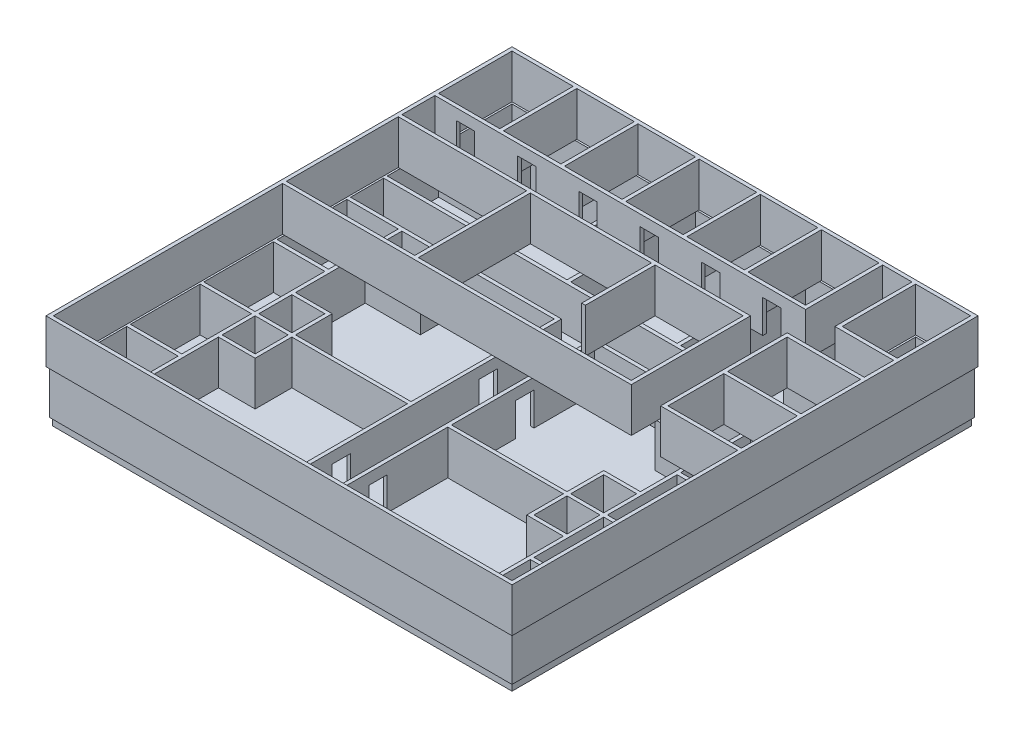
from build123d import *

# Parameters (mm, degrees)
SKETCH1_W                     = 3175
SKETCH1_H                     = 25.4
EXTRUDE_THIN7_DEPTH           = 304.8
SKETCH1_W_2                   = 3200.4
SKETCH1_H_2                   = 3200.4
SKETCH1_W_3                   = 3149.6
SKETCH1_H_3                   = 3149.6
EXTRUDE_THIN7_2_DEPTH         = 304.8
EXTRUDE_THIN7_3_DEPTH         = 304.8
EXTRUDE_THIN7_4_DEPTH         = 304.8
SKETCH1_W_4                   = 25.4
SKETCH1_H_4                   = 2032
EXTRUDE_THIN7_5_DEPTH         = 304.8
SKETCH1_W_5                   = 381
EXTRUDE_THIN7_6_DEPTH         = 304.8
EXTRUDE_THIN7_7_DEPTH         = 304.8
EXTRUDE_THIN7_8_DEPTH         = 304.8
EXTRUDE_THIN7_9_DEPTH         = 304.8
EXTRUDE_THIN7_10_DEPTH        = 304.8
EXTRUDE_THIN7_11_DEPTH        = 304.8
EXTRUDE_THIN7_12_DEPTH        = 304.8
EXTRUDE_THIN7_13_DEPTH        = 304.8
EXTRUDE_THIN7_14_DEPTH        = 304.8
EXTRUDE_THIN7_15_DEPTH        = 304.8
EXTRUDE_THIN7_16_DEPTH        = 304.8
EXTRUDE_THIN7_17_DEPTH        = 304.8
EXTRUDE_THIN7_18_DEPTH        = 304.8
SKETCH1_H_5                   = 889
EXTRUDE_THIN7_19_DEPTH        = 304.8
EXTRUDE_THIN7_20_DEPTH        = 304.8
SKETCH1_H_6                   = 254
EXTRUDE_THIN7_21_DEPTH        = 304.8
EXTRUDE_THIN7_22_DEPTH        = 304.8
EXTRUDE_THIN7_23_DEPTH        = 304.8
EXTRUDE_THIN7_24_DEPTH        = 304.8
EXTRUDE_THIN7_25_DEPTH        = 304.8
EXTRUDE_THIN7_26_DEPTH        = 304.8
EXTRUDE_THIN15_START          = 304.8
EXTRUDE_THIN15_OUTLINE_W      = 25.4
EXTRUDE_THIN15_OUTLINE_H      = 508
EXTRUDE_THIN15_DEPTH          = 304.8
EXTRUDE_THIN15_2_DEPTH        = 304.8
EXTRUDE_THIN15_3_OUTLINE_W    = 508
EXTRUDE_THIN15_3_OUTLINE_H    = 25.4
EXTRUDE_THIN15_3_DEPTH        = 304.8
EXTRUDE_THIN15_4_DEPTH        = 304.8
EXTRUDE_THIN15_5_DEPTH        = 304.8
EXTRUDE_THIN15_6_OUTLINE_W    = 25.4
EXTRUDE_THIN15_6_OUTLINE_H    = 825.5
EXTRUDE_THIN15_6_DEPTH        = 304.8
EXTRUDE_THIN15_7_OUTLINE_W    = 25.4
EXTRUDE_THIN15_7_OUTLINE_H    = 508
EXTRUDE_THIN15_7_DEPTH        = 304.8
EXTRUDE_THIN15_8_OUTLINE_W    = 25.4
EXTRUDE_THIN15_8_OUTLINE_H    = 508
EXTRUDE_THIN15_8_DEPTH        = 304.8
EXTRUDE_THIN15_9_OUTLINE_W    = 25.4
EXTRUDE_THIN15_9_OUTLINE_H    = 508
EXTRUDE_THIN15_9_DEPTH        = 304.8
EXTRUDE_THIN15_10_OUTLINE_W   = 25.4
EXTRUDE_THIN15_10_OUTLINE_H   = 508
EXTRUDE_THIN15_10_DEPTH       = 304.8
EXTRUDE_THIN15_11_DEPTH       = 304.8
EXTRUDE_THIN15_12_OUTLINE_W   = 3225.8
EXTRUDE_THIN15_12_OUTLINE_H   = 3225.8
EXTRUDE_THIN15_12_OUTLINE_W_2 = 3175
EXTRUDE_THIN15_12_OUTLINE_H_2 = 3175
EXTRUDE_THIN15_12_DEPTH       = 304.8
EXTRUDE_THIN15_13_OUTLINE_W   = 25.4
EXTRUDE_THIN15_13_OUTLINE_H   = 508
EXTRUDE_THIN15_13_DEPTH       = 304.8
CUT_EXTRUDE2_START            = -42.418
SKETCH3_W                     = 127
SKETCH3_H                     = 228.6
CUT_EXTRUDE2_DEPTH            = 69.596
LPATTERN2_COUNT               = 2
LPATTERN2_PITCH               = 254
LPATTERN2_COUNT_DIR2          = 2
LPATTERN2_PITCH_DIR2          = 1016
EXTRUDE_THIN16_START          = -50.8
EXTRUDE_THIN16_OUTLINE_W      = 3180.08
EXTRUDE_THIN16_OUTLINE_H      = 3180.08
EXTRUDE_THIN16_DEPTH          = 50.8
CUT_EXTRUDE4_DEPTH            = 19.05
CUT_EXTRUDE4_DEPTH_BACK       = 54.102
SKETCH5_W                     = 127
SKETCH5_H                     = 228.6
CUT_EXTRUDE5_START            = -61.722
SKETCH6_W                     = 127
SKETCH6_H                     = 228.6
CUT_EXTRUDE5_DEPTH            = 87.376
LPATTERN3_COUNT               = 6
LPATTERN3_PITCH               = 424.18


# Read off the part's stored shape, not the designer's step: Extrude-Thin15, Extrude-Thin16
with BuildPart() as part:
    # Sketch1 → Extrude-Thin7 (new body)
    with BuildSketch(Plane(origin=(0, 0, 698.5), x_dir=(1, 0, 0), z_dir=(0, 1, 0))):
        with Locations((0, 698.5)):
            Rectangle(SKETCH1_W, SKETCH1_H)
    extrude(amount=EXTRUDE_THIN7_DEPTH)



with BuildPart() as body_2:
    # Sketch1 → Extrude-Thin7 2 (new body)
    with BuildSketch(Plane(origin=(0, 0, 698.5), x_dir=(1, 0, 0), z_dir=(0, 1, 0))):
        Rectangle(SKETCH1_W_2, SKETCH1_H_2)
        Rectangle(SKETCH1_W_3, SKETCH1_H_3, mode=Mode.SUBTRACT)
    extrude(amount=EXTRUDE_THIN7_2_DEPTH)


with BuildPart() as body_3:
    # Sketch1 → Extrude-Thin7 3 (new body)
    with BuildSketch(Plane(origin=(0, 0, 698.5), x_dir=(1, 0, 0), z_dir=(0, 1, 0))):
        Polygon((1587.5, 457.2), (114.3, 457.2), (114.3, -1587.5), (139.7, -1587.5), (139.7, 431.8), (1587.5, 431.8), align=None)
    extrude(amount=EXTRUDE_THIN7_3_DEPTH)


with BuildPart() as body_4:
    # Sketch1 → Extrude-Thin7 4 (new body)
    with BuildSketch(Plane(origin=(0, 0, 698.5), x_dir=(1, 0, 0), z_dir=(0, 1, 0))):
        Polygon((-1587.5, 431.8), (-139.7, 431.8), (-139.7, -1587.5), (-114.3, -1587.5), (-114.3, 457.2), (-1587.5, 457.2), align=None)
    extrude(amount=EXTRUDE_THIN7_4_DEPTH)

    # Sketch3 → Cut-Extrude2 (cut)
    with BuildSketch(Plane(origin=(-114.3, 0, 0), x_dir=(0, 0, -1), z_dir=(1, 0, 0)).offset(CUT_EXTRUDE2_START)):
        with Locations((-749.3, 114.3)):
            Rectangle(SKETCH3_W, SKETCH3_H)
    cut_extrude2 = extrude(amount=CUT_EXTRUDE2_DEPTH, mode=Mode.SUBTRACT)


with BuildPart() as body_5:
    # Sketch1 → Extrude-Thin7 5 (new body)
    with BuildSketch(Plane(origin=(0, 0, 698.5), x_dir=(1, 0, 0), z_dir=(0, 1, 0))):
        with Locations((-1206.5, -571.5)):
            Rectangle(SKETCH1_W_4, SKETCH1_H_4)
    extrude(amount=EXTRUDE_THIN7_5_DEPTH)


with BuildPart() as body_6:
    # Sketch1 → Extrude-Thin7 6 (new body)
    with BuildSketch(Plane(origin=(0, 0, 698.5), x_dir=(1, 0, 0), z_dir=(0, 1, 0))):
        with Locations((-1397, -63.5)):
            Rectangle(SKETCH1_W_5, SKETCH1_H)
    extrude(amount=EXTRUDE_THIN7_6_DEPTH)


with BuildPart() as body_7:
    # Sketch1 → Extrude-Thin7 7 (new body)
    with BuildSketch(Plane(origin=(0, 0, 698.5), x_dir=(1, 0, 0), z_dir=(0, 1, 0))):
        Polygon((-127, -558.8), (-1206.5, -558.8), (-1587.5, -558.8), (-1587.5, -584.2), (-1206.5, -584.2), (-127, -584.2), align=None)
    extrude(amount=EXTRUDE_THIN7_7_DEPTH)


with BuildPart() as body_8:
    # Sketch1 → Extrude-Thin7 8 (new body)
    with BuildSketch(Plane(origin=(0, 0, 698.5), x_dir=(1, 0, 0), z_dir=(0, 1, 0))):
        with Locations((-1397, -1079.5)):
            Rectangle(SKETCH1_W_5, SKETCH1_H)
    extrude(amount=EXTRUDE_THIN7_8_DEPTH)


with BuildPart() as body_9:
    # Sketch1 → Extrude-Thin7 9 (new body)
    with BuildSketch(Plane(origin=(0, 0, 698.5), x_dir=(1, 0, 0), z_dir=(0, 1, 0))):
        Polygon((-1206.5, -330.2), (-965.2, -330.2), (-965.2, -571.5), (-965.2, -812.8), (-1206.5, -812.8), (-1206.5, -838.2), (-939.8, -838.2), (-939.8, -571.5), (-939.8, -304.8), (-1206.5, -304.8), align=None)
    extrude(amount=EXTRUDE_THIN7_9_DEPTH)


with BuildPart() as body_10:
    # Sketch1 → Extrude-Thin7 10 (new body)
    with BuildSketch(Plane(origin=(0, 0, 698.5), x_dir=(1, 0, 0), z_dir=(0, 1, 0))):
        Polygon((-1206.5, -1346.2), (-838.2, -1346.2), (-838.2, -1587.5), (-812.8, -1587.5), (-812.8, -1320.8), (-1206.5, -1320.8), align=None)
    extrude(amount=EXTRUDE_THIN7_10_DEPTH)


with BuildPart() as body_11:
    # Sketch1 → Extrude-Thin7 11 (new body)
    with BuildSketch(Plane(origin=(0, 0, 698.5), x_dir=(1, 0, 0), z_dir=(0, 1, 0))):
        Polygon((-1206.5, 177.8), (-812.8, 177.8), (-812.8, 444.5), (-838.2, 444.5), (-838.2, 203.2), (-1206.5, 203.2), align=None)
    extrude(amount=EXTRUDE_THIN7_11_DEPTH)


with BuildPart() as body_12:
    # Sketch1 → Extrude-Thin7 12 (new body)
    with BuildSketch(Plane(origin=(0, 0, 698.5), x_dir=(1, 0, 0), z_dir=(0, 1, 0))):
        Polygon((1206.5, 203.2), (838.2, 203.2), (838.2, 444.5), (812.8, 444.5), (812.8, 177.8), (1206.5, 177.8), align=None)
    extrude(amount=EXTRUDE_THIN7_12_DEPTH)


with BuildPart() as body_13:
    # Sketch1 → Extrude-Thin7 13 (new body)
    with BuildSketch(Plane(origin=(0, 0, 698.5), x_dir=(1, 0, 0), z_dir=(0, 1, 0))):
        Polygon((1206.5, -812.8), (965.2, -812.8), (965.2, -571.5), (965.2, -330.2), (1206.5, -330.2), (1206.5, -304.8), (939.8, -304.8), (939.8, -571.5), (939.8, -838.2), (1206.5, -838.2), align=None)
    extrude(amount=EXTRUDE_THIN7_13_DEPTH)


with BuildPart() as body_14:
    # Sketch1 → Extrude-Thin7 14 (new body)
    with BuildSketch(Plane(origin=(0, 0, 698.5), x_dir=(1, 0, 0), z_dir=(0, 1, 0))):
        Polygon((1206.5, -1320.8), (812.8, -1320.8), (812.8, -1587.5), (838.2, -1587.5), (838.2, -1346.2), (1206.5, -1346.2), align=None)
    extrude(amount=EXTRUDE_THIN7_14_DEPTH)


with BuildPart() as body_15:
    # Sketch1 → Extrude-Thin7 15 (new body)
    with BuildSketch(Plane(origin=(0, 0, 698.5), x_dir=(1, 0, 0), z_dir=(0, 1, 0))):
        Polygon((1587.5, -558.8), (1206.5, -558.8), (127, -558.8), (127, -584.2), (1206.5, -584.2), (1587.5, -584.2), align=None)
    extrude(amount=EXTRUDE_THIN7_15_DEPTH)


with BuildPart() as body_16:
    # Sketch1 → Extrude-Thin7 16 (new body)
    with BuildSketch(Plane(origin=(0, 0, 698.5), x_dir=(1, 0, 0), z_dir=(0, 1, 0))):
        with Locations((1397, -1079.5)):
            Rectangle(SKETCH1_W_5, SKETCH1_H)
    extrude(amount=EXTRUDE_THIN7_16_DEPTH)


with BuildPart() as body_17:
    # Sketch1 → Extrude-Thin7 17 (new body)
    with BuildSketch(Plane(origin=(0, 0, 698.5), x_dir=(1, 0, 0), z_dir=(0, 1, 0))):
        with Locations((1397, -63.5)):
            Rectangle(SKETCH1_W_5, SKETCH1_H)
    extrude(amount=EXTRUDE_THIN7_17_DEPTH)


with BuildPart() as body_18:
    # Sketch1 → Extrude-Thin7 18 (new body)
    with BuildSketch(Plane(origin=(0, 0, 698.5), x_dir=(1, 0, 0), z_dir=(0, 1, 0))):
        with Locations((1206.5, -571.5)):
            Rectangle(SKETCH1_W_4, SKETCH1_H_4)
    extrude(amount=EXTRUDE_THIN7_18_DEPTH)


with BuildPart() as body_19:
    # Sketch1 → Extrude-Thin7 19 (new body)
    with BuildSketch(Plane(origin=(0, 0, 698.5), x_dir=(1, 0, 0), z_dir=(0, 1, 0))):
        with Locations((-317.5, 1143)):
            Rectangle(SKETCH1_W_4, SKETCH1_H_5)
    extrude(amount=EXTRUDE_THIN7_19_DEPTH)


with BuildPart() as body_20:
    # Sketch1 → Extrude-Thin7 20 (new body)
    with BuildSketch(Plane(origin=(0, 0, 698.5), x_dir=(1, 0, 0), z_dir=(0, 1, 0))):
        Polygon((444.5, 1346.2), (-317.5, 1346.2), (-1587.5, 1346.2), (-1587.5, 1320.8), (-317.5, 1320.8), (444.5, 1320.8), align=None)
    extrude(amount=EXTRUDE_THIN7_20_DEPTH)


with BuildPart() as body_21:
    # Sketch1 → Extrude-Thin7 21 (new body)
    with BuildSketch(Plane(origin=(0, 0, 698.5), x_dir=(1, 0, 0), z_dir=(0, 1, 0))):
        with Locations((-952.5, 1460.5)):
            Rectangle(SKETCH1_W_4, SKETCH1_H_6)
    extrude(amount=EXTRUDE_THIN7_21_DEPTH)


with BuildPart() as body_22:
    # Sketch1 → Extrude-Thin7 22 (new body)
    with BuildSketch(Plane(origin=(0, 0, 698.5), x_dir=(1, 0, 0), z_dir=(0, 1, 0))):
        Polygon((-1219.2, 1333.5), (-1219.2, 1092.2), (-1587.5, 1092.2), (-1587.5, 1066.8), (-1193.8, 1066.8), (-1193.8, 1333.5), align=None)
    extrude(amount=EXTRUDE_THIN7_22_DEPTH)


with BuildPart() as body_23:
    # Sketch1 → Extrude-Thin7 23 (new body)
    with BuildSketch(Plane(origin=(0, 0, 698.5), x_dir=(1, 0, 0), z_dir=(0, 1, 0))):
        Polygon((-584.2, 1333.5), (-584.2, 1066.8), (-317.5, 1066.8), (-317.5, 1092.2), (-558.8, 1092.2), (-558.8, 1333.5), align=None)
    extrude(amount=EXTRUDE_THIN7_23_DEPTH)


with BuildPart() as body_24:
    # Sketch1 → Extrude-Thin7 24 (new body)
    with BuildSketch(Plane(origin=(0, 0, 698.5), x_dir=(1, 0, 0), z_dir=(0, 1, 0))):
        with Locations((444.5, 1143)):
            Rectangle(SKETCH1_W_4, SKETCH1_H_5)
    extrude(amount=EXTRUDE_THIN7_24_DEPTH)


with BuildPart() as body_25:
    # Sketch1 → Extrude-Thin7 25 (new body)
    with BuildSketch(Plane(origin=(0, 0, 698.5), x_dir=(1, 0, 0), z_dir=(0, 1, 0))):
        Polygon((685.8, 1587.5), (685.8, 1320.8), (952.5, 1320.8), (1219.2, 1320.8), (1219.2, 1587.5), (1193.8, 1587.5), (1193.8, 1346.2), (952.5, 1346.2), (711.2, 1346.2), (711.2, 1587.5), align=None)
    extrude(amount=EXTRUDE_THIN7_25_DEPTH)


with BuildPart() as body_26:
    # Sketch1 → Extrude-Thin7 26 (new body)
    with BuildSketch(Plane(origin=(0, 0, 698.5), x_dir=(1, 0, 0), z_dir=(0, 1, 0))):
        Polygon((939.8, 1587.5), (939.8, 939.8), (1587.5, 939.8), (1587.5, 965.2), (965.2, 965.2), (965.2, 1587.5), align=None)
    extrude(amount=EXTRUDE_THIN7_26_DEPTH)


with BuildPart() as body_27:
    # Extrude-Thin15 outline → Extrude-Thin15 (new body)
    with BuildSketch(Plane(origin=(0, 0, 0), x_dir=(1, 0, 0), z_dir=(0, 1, 0)).offset(EXTRUDE_THIN15_START)):
        with Locations((177.8, -127)):
            Rectangle(EXTRUDE_THIN15_OUTLINE_W, EXTRUDE_THIN15_OUTLINE_H)
    extrude(amount=EXTRUDE_THIN15_DEPTH)


with BuildPart() as body_28:
    # Extrude-Thin15 2 outline → Extrude-Thin15 2 (new body)
    with BuildSketch(Plane(origin=(0, 0, 0), x_dir=(1, 0, 0), z_dir=(0, 1, 0)).offset(EXTRUDE_THIN15_START)):
        Polygon((1181.1, 355.6), (1587.5, 355.6), (1587.5, 381), (1206.5, 381), (1206.5, 889), (1181.1, 889), align=None)
    extrude(amount=EXTRUDE_THIN15_2_DEPTH)


with BuildPart() as body_29:
    # Extrude-Thin15 3 outline → Extrude-Thin15 3 (new body)
    with BuildSketch(Plane(origin=(0, 0, 0), x_dir=(1, 0, 0), z_dir=(0, 1, 0)).offset(EXTRUDE_THIN15_START)):
        with Locations((1333.5, -298.45)):
            Rectangle(EXTRUDE_THIN15_3_OUTLINE_W, EXTRUDE_THIN15_3_OUTLINE_H)
    extrude(amount=EXTRUDE_THIN15_3_DEPTH)


with BuildPart() as body_30:
    # Extrude-Thin15 4 outline → Extrude-Thin15 4 (new body)
    with BuildSketch(Plane(origin=(0, 0, 0), x_dir=(1, 0, 0), z_dir=(0, 1, 0)).offset(EXTRUDE_THIN15_START)):
        Polygon((1054.1, -723.9), (1587.5, -723.9), (1587.5, -698.5), (1079.5, -698.5), (1079.5, 127), (1587.5, 127), (1587.5, 152.4), (1054.1, 152.4), align=None)
    extrude(amount=EXTRUDE_THIN15_4_DEPTH)


with BuildPart() as body_31:
    # Extrude-Thin15 5 outline → Extrude-Thin15 5 (new body)
    with BuildSketch(Plane(origin=(0, 0, 0), x_dir=(1, 0, 0), z_dir=(0, 1, 0)).offset(EXTRUDE_THIN15_START)):
        Polygon((800.1, -673.1), (-1587.5, -673.1), (-1587.5, -698.5), (825.5, -698.5), (825.5, 127), (-1587.5, 127), (-1587.5, 101.6), (800.1, 101.6), align=None)
    extrude(amount=EXTRUDE_THIN15_5_DEPTH)


with BuildPart() as body_32:
    # Extrude-Thin15 6 outline → Extrude-Thin15 6 (new body)
    with BuildSketch(Plane(origin=(0, 0, 0), x_dir=(1, 0, 0), z_dir=(0, 1, 0)).offset(EXTRUDE_THIN15_START)):
        with Locations((-685.8, -285.75)):
            Rectangle(EXTRUDE_THIN15_6_OUTLINE_W, EXTRUDE_THIN15_6_OUTLINE_H)
    extrude(amount=EXTRUDE_THIN15_6_DEPTH)


with BuildPart() as body_33:
    # Extrude-Thin15 7 outline → Extrude-Thin15 7 (new body)
    with BuildSketch(Plane(origin=(0, 0, 0), x_dir=(1, 0, 0), z_dir=(0, 1, 0)).offset(EXTRUDE_THIN15_START)):
        with Locations((541.866666667, 635)):
            Rectangle(EXTRUDE_THIN15_7_OUTLINE_W, EXTRUDE_THIN15_7_OUTLINE_H)
    extrude(amount=EXTRUDE_THIN15_7_DEPTH)


with BuildPart() as body_34:
    # Extrude-Thin15 8 outline → Extrude-Thin15 8 (new body)
    with BuildSketch(Plane(origin=(0, 0, 0), x_dir=(1, 0, 0), z_dir=(0, 1, 0)).offset(EXTRUDE_THIN15_START)):
        with Locations((118.533333333, 635)):
            Rectangle(EXTRUDE_THIN15_8_OUTLINE_W, EXTRUDE_THIN15_8_OUTLINE_H)
    extrude(amount=EXTRUDE_THIN15_8_DEPTH)


with BuildPart() as body_35:
    # Extrude-Thin15 9 outline → Extrude-Thin15 9 (new body)
    with BuildSketch(Plane(origin=(0, 0, 0), x_dir=(1, 0, 0), z_dir=(0, 1, 0)).offset(EXTRUDE_THIN15_START)):
        with Locations((-304.8, 635)):
            Rectangle(EXTRUDE_THIN15_9_OUTLINE_W, EXTRUDE_THIN15_9_OUTLINE_H)
    extrude(amount=EXTRUDE_THIN15_9_DEPTH)


with BuildPart() as body_36:
    # Extrude-Thin15 10 outline → Extrude-Thin15 10 (new body)
    with BuildSketch(Plane(origin=(0, 0, 0), x_dir=(1, 0, 0), z_dir=(0, 1, 0)).offset(EXTRUDE_THIN15_START)):
        with Locations((-728.133333333, 635)):
            Rectangle(EXTRUDE_THIN15_10_OUTLINE_W, EXTRUDE_THIN15_10_OUTLINE_H)
    extrude(amount=EXTRUDE_THIN15_10_DEPTH)


with BuildPart() as body_37:
    # Extrude-Thin15 11 outline → Extrude-Thin15 11 (new body)
    with BuildSketch(Plane(origin=(0, 0, 0), x_dir=(1, 0, 0), z_dir=(0, 1, 0)).offset(EXTRUDE_THIN15_START)):
        Polygon((977.9, 355.6), (977.9, 889), (952.5, 889), (952.5, 381), (-1587.5, 381), (-1587.5, 355.6), align=None)
    extrude(amount=EXTRUDE_THIN15_11_DEPTH)

    # Sketch6 → Cut-Extrude5 (cut)
    with BuildSketch(Plane.XY.offset(-355.6).offset(CUT_EXTRUDE5_START)):
        with Locations((-1375.875666667, 419.1)):
            Rectangle(SKETCH6_W, SKETCH6_H)
    cut_extrude5 = extrude(amount=CUT_EXTRUDE5_DEPTH, mode=Mode.SUBTRACT)

    # LPattern3: Cut-Extrude5 ×6
    with Locations(*[(i * LPATTERN3_PITCH, 0, 0) for i in range(1, LPATTERN3_COUNT)]):
        add(cut_extrude5, mode=Mode.SUBTRACT)


with BuildPart() as body_38:
    # Extrude-Thin15 12 outline → Extrude-Thin15 12 (new body)
    with BuildSketch(Plane(origin=(0, 0, 0), x_dir=(1, 0, 0), z_dir=(0, 1, 0)).offset(EXTRUDE_THIN15_START)):
        with Locations((0, -698.5)):
            Rectangle(EXTRUDE_THIN15_12_OUTLINE_W, EXTRUDE_THIN15_12_OUTLINE_H)
        with Locations((0, -698.5)):
            Rectangle(EXTRUDE_THIN15_12_OUTLINE_W_2, EXTRUDE_THIN15_12_OUTLINE_H_2, mode=Mode.SUBTRACT)
    extrude(amount=EXTRUDE_THIN15_12_DEPTH)


with BuildPart() as body_39:
    # Extrude-Thin15 13 outline → Extrude-Thin15 13 (new body)
    with BuildSketch(Plane(origin=(0, 0, 0), x_dir=(1, 0, 0), z_dir=(0, 1, 0)).offset(EXTRUDE_THIN15_START)):
        with Locations((-1151.466666667, 635)):
            Rectangle(EXTRUDE_THIN15_13_OUTLINE_W, EXTRUDE_THIN15_13_OUTLINE_H)
    extrude(amount=EXTRUDE_THIN15_13_DEPTH)

    # Combine5: union body 38, body 37, body 36, body 35, body 34, body 33, body 32, body 31, body 30, body 29, body 28, body 27
    add(body_38.part)
    add(body_37.part)
    add(body_36.part)
    add(body_35.part)
    add(body_34.part)
    add(body_33.part)
    add(body_32.part)
    add(body_31.part)
    add(body_30.part)
    add(body_29.part)
    add(body_28.part)
    add(body_27.part)


with BuildPart() as lpattern2_tool:
    # LPattern2: Cut-Extrude2 2 × 2
    with Locations(*[(i * LPATTERN2_PITCH, 0, j * LPATTERN2_PITCH_DIR2) for i in range(LPATTERN2_COUNT) for j in range(LPATTERN2_COUNT_DIR2) if (i, j) != (0, 0)]):
        add(cut_extrude2)


with BuildPart() as body_3_1:
    add(body_3.part)

    # LPattern2: cut by lpattern2_tool
    add(lpattern2_tool.part, mode=Mode.SUBTRACT)


with BuildPart() as body_4_1:
    add(body_4.part)

    # LPattern2: cut by lpattern2_tool
    add(lpattern2_tool.part, mode=Mode.SUBTRACT)


with BuildPart() as part_1:
    add(part.part)

    add(body_2.part)  # Extrude-Thin16 merges body 2

    add(body_3_1.part)  # Extrude-Thin16 merges body 3

    add(body_4_1.part)  # Extrude-Thin16 merges body 4

    add(body_5.part)  # Extrude-Thin16 merges body 5

    add(body_6.part)  # Extrude-Thin16 merges body 6

    add(body_7.part)  # Extrude-Thin16 merges body 7

    add(body_8.part)  # Extrude-Thin16 merges body 8

    add(body_9.part)  # Extrude-Thin16 merges body 9

    add(body_10.part)  # Extrude-Thin16 merges body 10

    add(body_11.part)  # Extrude-Thin16 merges body 11

    add(body_12.part)  # Extrude-Thin16 merges body 12

    add(body_13.part)  # Extrude-Thin16 merges body 13

    add(body_14.part)  # Extrude-Thin16 merges body 14

    add(body_15.part)  # Extrude-Thin16 merges body 15

    add(body_16.part)  # Extrude-Thin16 merges body 16

    add(body_17.part)  # Extrude-Thin16 merges body 17

    add(body_18.part)  # Extrude-Thin16 merges body 18

    add(body_19.part)  # Extrude-Thin16 merges body 19

    add(body_20.part)  # Extrude-Thin16 merges body 20

    add(body_21.part)  # Extrude-Thin16 merges body 21

    add(body_22.part)  # Extrude-Thin16 merges body 22

    add(body_23.part)  # Extrude-Thin16 merges body 23

    add(body_24.part)  # Extrude-Thin16 merges body 24

    add(body_25.part)  # Extrude-Thin16 merges body 25

    add(body_26.part)  # Extrude-Thin16 merges body 26
    # Extrude-Thin16 outline → Extrude-Thin16 (add)
    with BuildSketch(Plane(origin=(0, 0, 698.5), x_dir=(1, 0, 0), z_dir=(0, 1, 0)).offset(EXTRUDE_THIN16_START)):
        Rectangle(EXTRUDE_THIN16_OUTLINE_W, EXTRUDE_THIN16_OUTLINE_H)
    extrude(amount=EXTRUDE_THIN16_DEPTH)

    # Sketch5 → Cut-Extrude4 (cut, two sides: drawn at the far end of the back side and taken through both)
    with BuildSketch(Plane.XY.offset(12.7).offset(-CUT_EXTRUDE4_DEPTH_BACK)):
        with Locations((-965.2, 114.3)):
            Rectangle(SKETCH5_W, SKETCH5_H)
    extrude(amount=CUT_EXTRUDE4_DEPTH + CUT_EXTRUDE4_DEPTH_BACK, mode=Mode.SUBTRACT)


solid = Compound([body_39.part, part_1.part])
